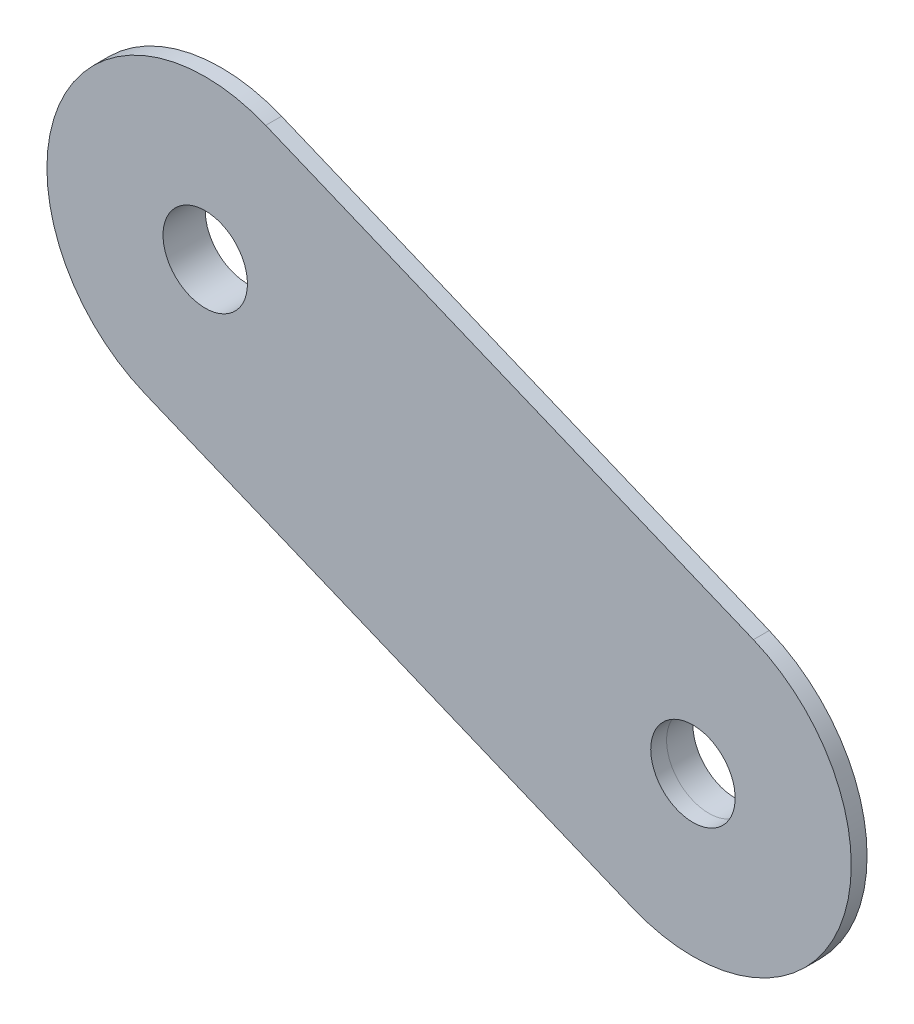
from build123d import *

# Parameters (mm, degrees)
SKETCH1_R             = 7.5
SKETCH1_R_2           = 4
BOSS_EXTRUDE1_DEPTH   = 2.5
BOSS_EXTRUDE1_2_DEPTH = 2.5
SKETCH2_R             = 4
BOSS_EXTRUDE2_DEPTH   = 1.5


with BuildPart() as part:
    # Sketch1 → Boss-Extrude1 (new body)
    with BuildSketch(Plane.XY):
        Circle(SKETCH1_R)
        Circle(SKETCH1_R_2, mode=Mode.SUBTRACT)
    extrude(amount=BOSS_EXTRUDE1_DEPTH)

    # Sketch2 → Boss-Extrude2 (add)
    with BuildSketch(Plane.XY.offset(2.5)):
        with BuildLine():
            Line((5.72773978, 13.863368891), (51.938969417, -5.229097043))
            ThreePointArc((51.938969417, -5.229097043), (60.074598528, -24.820205715), (40.483489857, -32.955834825))
            Line((40.483489857, -32.955834825), (-5.72773978, -13.863368891))
            ThreePointArc((-5.72773978, -13.863368891), (-13.863368891, 5.72773978), (5.72773978, 13.863368891))
        make_face()
        Circle(SKETCH2_R, mode=Mode.SUBTRACT)
        with Locations((46.211229637, -19.092465934)):
            Circle(SKETCH2_R, mode=Mode.SUBTRACT)
    extrude(amount=BOSS_EXTRUDE2_DEPTH)


with BuildPart() as body_2:
    # Sketch1 → Boss-Extrude1 2 (new body)
    with BuildSketch(Plane.XY):
        with Locations((46.211229637, -19.092465934)):
            Circle(SKETCH1_R)
        with Locations((46.211229637, -19.092465934)):
            Circle(SKETCH1_R_2, mode=Mode.SUBTRACT)
    extrude(amount=BOSS_EXTRUDE1_2_DEPTH)


solid = Compound([part.part, body_2.part])
